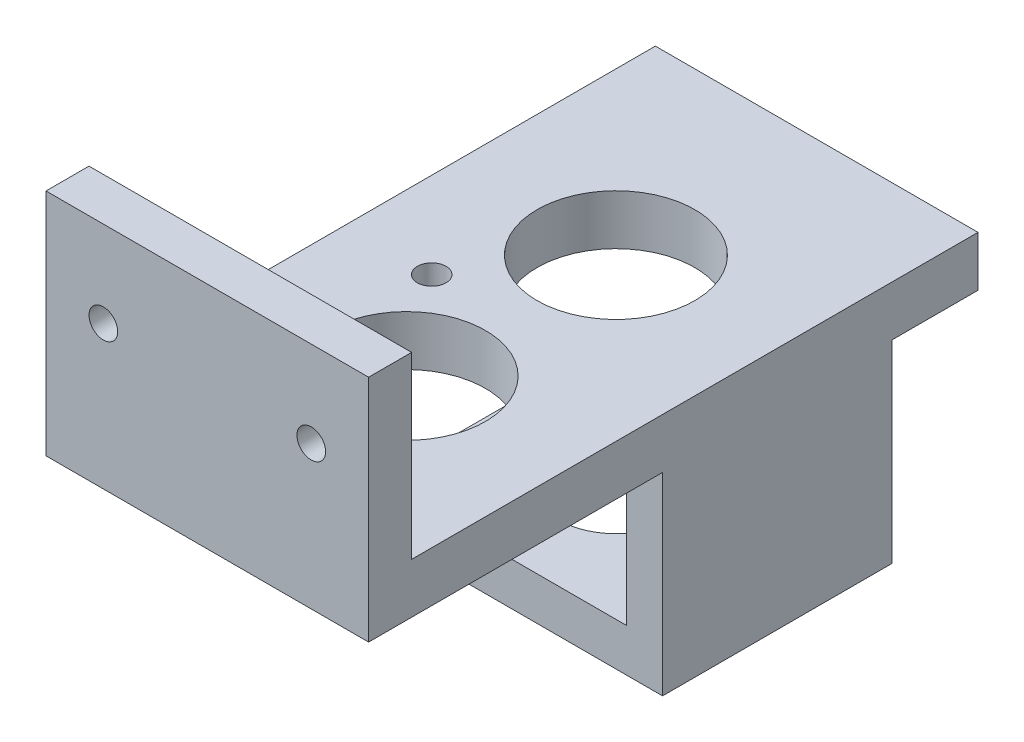
from build123d import *

# Parameters (mm, degrees)
SKETCH1_W           = 45
SKETCH1_H           = 85
BOSS_EXTRUDE1_DEPTH = 7
SKETCH2_R           = 11
CUT_EXTRUDE1_DEPTH  = 100
SKETCH3_R           = 11
CUT_EXTRUDE2_DEPTH  = 7
SKETCH4_W           = 45
SKETCH4_H           = 6
BOSS_EXTRUDE3_DEPTH = 25
SKETCH5_R           = 2
CUT_EXTRUDE3_DEPTH  = 14
SKETCH6_R           = 2
CUT_EXTRUDE4_DEPTH  = 14
SKETCH7_W           = 5
SKETCH7_H           = 32
BOSS_EXTRUDE4_DEPTH = 27
SKETCH8_W           = 32
SKETCH8_H           = 6
BOSS_EXTRUDE5_DEPTH = 35
SKETCH9_R           = 8
CUT_EXTRUDE6_DEPTH  = 50


with BuildPart() as part:
    # Sketch1 → Boss-Extrude1 (new body)
    with BuildSketch(Plane(origin=(0, 0, 0), x_dir=(1, 0, 0), z_dir=(0, 1, 0))):
        with Locations((-27.66194332, -13.734817814)):
            Rectangle(SKETCH1_W, SKETCH1_H)
    extrude(amount=BOSS_EXTRUDE1_DEPTH)

    # Sketch2 → Cut-Extrude1 (cut)
    with BuildSketch(Plane(origin=(0, 7, 0), x_dir=(1, 0, 0), z_dir=(0, 1, 0))):
        with Locations((-27.66194332, 0.765182186)):
            Circle(SKETCH2_R)
    extrude(amount=-CUT_EXTRUDE1_DEPTH, mode=Mode.SUBTRACT)

    # Sketch3 → Cut-Extrude2 (cut)
    with BuildSketch(Plane(origin=(0, 7, 0), x_dir=(1, 0, 0), z_dir=(0, 1, 0))):
        with Locations((-27.66194332, -28.434817814)):
            Circle(SKETCH3_R)
    extrude(amount=-CUT_EXTRUDE2_DEPTH, mode=Mode.SUBTRACT)

    # Sketch4 → Boss-Extrude3 (add)
    with BuildSketch(Plane(origin=(0, 7, 0), x_dir=(1, 0, 0), z_dir=(0, 1, 0))):
        with Locations((-27.66194332, -53.234817814)):
            Rectangle(SKETCH4_W, SKETCH4_H)
    extrude(amount=BOSS_EXTRUDE3_DEPTH)

    # Sketch5 → Cut-Extrude3 (cut)
    with BuildSketch(Plane(origin=(0, 0, 50.234817814), x_dir=(-1, 0, 0), z_dir=(0, 0, -1))):
        with Locations((42.16194332, 20)):
            Circle(SKETCH5_R)
        with Locations((13.16194332, 20)):
            Circle(SKETCH5_R)
    extrude(amount=-CUT_EXTRUDE3_DEPTH, mode=Mode.SUBTRACT)

    # Sketch6 → Cut-Extrude4 (cut)
    with BuildSketch(Plane(origin=(0, 7, 0), x_dir=(1, 0, 0), z_dir=(0, 1, 0))):
        with Locations((-38.16194332, -14.434817814)):
            Circle(SKETCH6_R)
        with Locations((-38.16194332, -42.434817814)):
            Circle(SKETCH6_R)
    extrude(amount=-CUT_EXTRUDE4_DEPTH, mode=Mode.SUBTRACT)

    # Sketch7 → Boss-Extrude4 (add)
    with BuildSketch(Plane.XZ):
        with Locations((-7.66194332, -0.765182186)):
            Rectangle(SKETCH7_W, SKETCH7_H)
    extrude(amount=BOSS_EXTRUDE4_DEPTH)

    # Sketch8 → Boss-Extrude5 (add)
    with BuildSketch(Plane.ZY.offset(10.16194332)):
        with Locations((-0.765182186, -24)):
            Rectangle(SKETCH8_W, SKETCH8_H)
    extrude(amount=BOSS_EXTRUDE5_DEPTH)

    # Sketch9 → Cut-Extrude6 (cut)
    with BuildSketch(Plane(origin=(0, 7, 0), x_dir=(1, 0, 0), z_dir=(0, 1, 0))):
        with Locations((-27.66194332, 0.765182186)):
            Circle(SKETCH9_R)
    extrude(amount=-CUT_EXTRUDE6_DEPTH, mode=Mode.SUBTRACT)


solid = part.part
